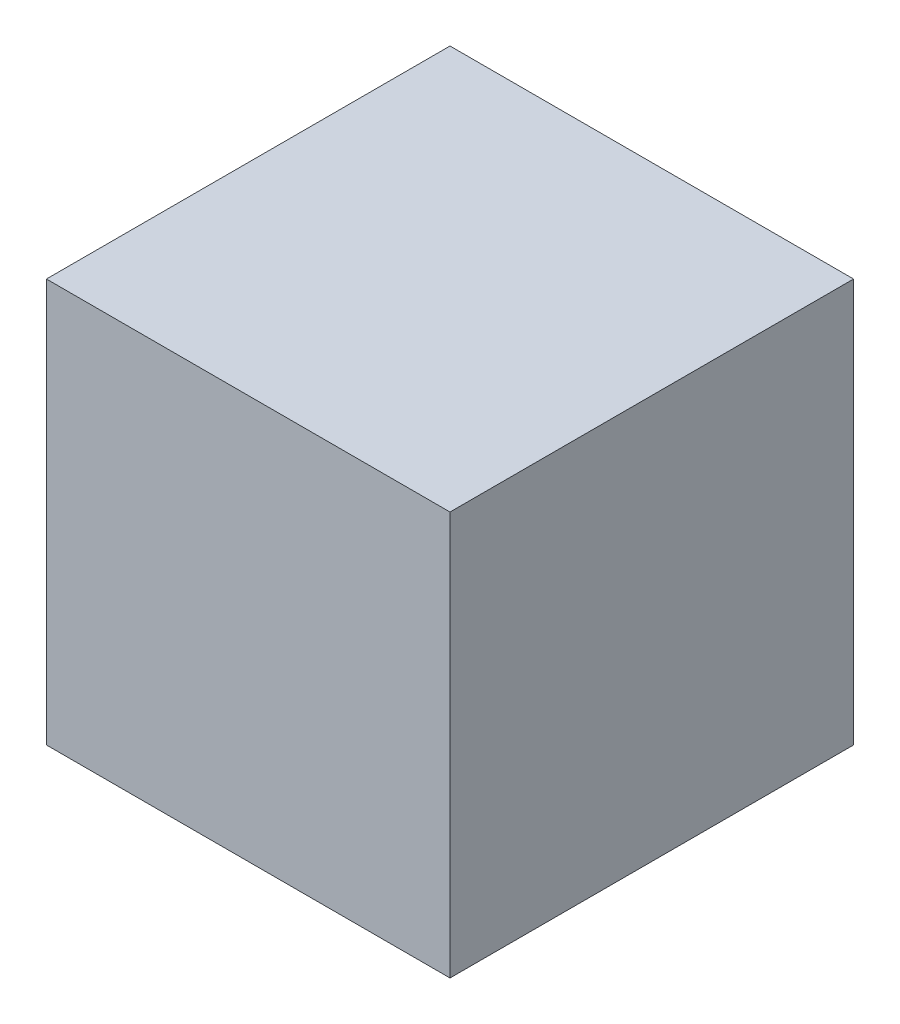
from build123d import *

# Parameters (mm, degrees)
BOSS_EXTRUDE1_DEPTH      = 250
BOSS_EXTRUDE1_DEPTH_BACK = 250
SKETCH1_W                = 500
SKETCH1_H                = 500


with BuildPart() as part:
    # Sketch1 → Boss-Extrude1 (new, two sides: drawn at the far end of the back side and taken through both)
    with BuildSketch(Plane.XY.offset(-BOSS_EXTRUDE1_DEPTH_BACK)):
        Rectangle(SKETCH1_W, SKETCH1_H)
    extrude(amount=BOSS_EXTRUDE1_DEPTH + BOSS_EXTRUDE1_DEPTH_BACK)


solid = part.part
